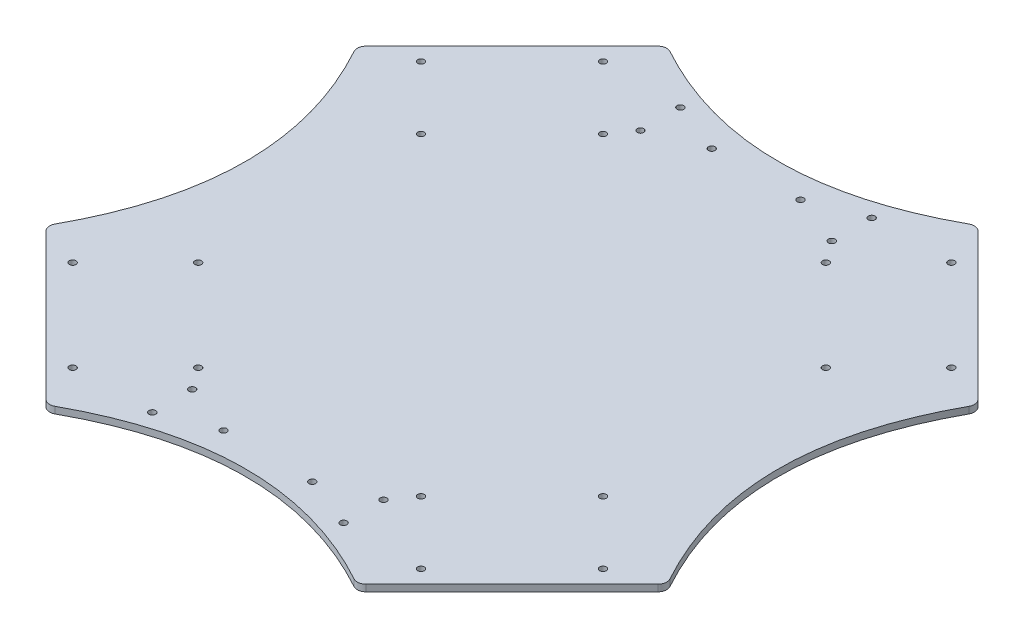
from build123d import *

# Parameters (mm, degrees)
DODANIE_WYCI_GNI_CIE1_DEPTH = 3
ZAOKR_GLENIE1_R             = 4
SZKIC2_R                    = 1.5
WYTNIJ_WYCI_GNI_CIE1_DEPTH  = 197.640104054
SZYK_KO_OWY1_COUNT          = 4
SZKIC3_R                    = 1.5
WYTNIJ_WYCI_GNI_CIE2_DEPTH  = 197.640104054
SZYK_KO_OWY2_OUTLINE_R      = 1.5
SZYK_KO_OWY2_DEPTH          = 3


# Read off the part's stored shape, not the designer's step: Szyk kołowy2
with BuildPart() as part:
    # Szkic1 → Dodanie-wyciągnięcie1 (new body)
    with BuildSketch(Plane(origin=(0, 0, 0), x_dir=(1, 0, 0), z_dir=(0, 1, 0))):
        with BuildLine():
            Line((-70, -140), (-140, -70))
            add(Edge.make_bspline(
                [(-140, 70), (-100, 0), (-140, -70)],
                knots=[0, 0, 0, 1, 1, 1], degree=2))
            Line((-140, 70), (-70, 140))
            add(Edge.make_bspline(
                [(70, 140), (0, 100), (-70, 140)],
                knots=[0, 0, 0, 1, 1, 1], degree=2))
            Line((70, 140), (140, 70))
            add(Edge.make_bspline(
                [(140, -70), (100, 0), (140, 70)],
                knots=[0, 0, 0, 1, 1, 1], degree=2))
            Line((140, -70), (70, -140))
            add(Edge.make_bspline(
                [(-70, -140), (0, -100), (70, -140)],
                knots=[0, 0, 0, 1, 1, 1], degree=2))
        make_face()
    extrude(amount=DODANIE_WYCI_GNI_CIE1_DEPTH)

    # Zaokrąglenie1
    zaokr_glenie1_edges = [part.edges().sort_by_distance(p)[0] for p in [
        (-140, 1.5, -70),
        (-70, 1.5, -140),
        (70, 1.5, -140),
        (140, 1.5, -70),
        (140, 1.5, 70),
        (70, 1.5, 140),
        (-140, 1.5, 70),
        (-70, 1.5, 140),
    ]]
    fillet(zaokr_glenie1_edges, radius=ZAOKR_GLENIE1_R)

    # Szkic2 → Wytnij-wyciągnięcie1 (cut, through all)
    with BuildSketch(Plane(origin=(0, 3, 0), x_dir=(1, 0, 0), z_dir=(0, 1, 0))):
        with Locations(Location((-78.488852712, -119.501046021, 0), (0, 0, 270))):
            Circle(SZKIC2_R)
        with Locations(Location((-119.501046021, -78.488852712, 0), (0, 0, 90))):
            Circle(SZKIC2_R)
        with Locations(Location((-50.204581464, -91.216774773, 0), (0, 0, 90))):
            Circle(SZKIC2_R)
        with Locations(Location((-91.216774773, -50.204581464, 0), (0, 0, 270))):
            Circle(SZKIC2_R)
    wytnij_wyci_gni_cie1 = extrude(amount=-WYTNIJ_WYCI_GNI_CIE1_DEPTH, mode=Mode.SUBTRACT)

    # Szyk kołowy1: Wytnij-wyciągnięcie1 ×4 about axis
    szyk_ko_owy1_axis = Axis((0, 0, 0), (0, 1, 0))
    for i in range(1, SZYK_KO_OWY1_COUNT):
        add(wytnij_wyci_gni_cie1.rotate(szyk_ko_owy1_axis, i * 360 / SZYK_KO_OWY1_COUNT), mode=Mode.SUBTRACT)

    # Szkic3 → Wytnij-wyciągnięcie2 (cut, through all)
    with BuildSketch(Plane(origin=(0, 3, 0), x_dir=(1, 0, 0), z_dir=(0, 1, 0))):
        with Locations(Location((-43.1, -119, 0), (0, 0, 270))):
            Circle(SZKIC3_R)
        with Locations(Location((-20, -110, 0), (0, 0, 270))):
            Circle(SZKIC3_R)
        with Locations(Location((-43.1, -101, 0), (0, 0, 90))):
            Circle(SZKIC3_R)
    wytnij_wyci_gni_cie2 = extrude(amount=-WYTNIJ_WYCI_GNI_CIE2_DEPTH, mode=Mode.SUBTRACT)

    # Lustro1: Wytnij-wyciągnięcie2 across plane
    add(wytnij_wyci_gni_cie2.mirror(Plane(origin=(0, 0, 0), x_dir=(0, 0, 1), z_dir=(1, 0, 0))), mode=Mode.SUBTRACT)

    # Szyk kołowy2 outline → Szyk kołowy2 (cut)
    with BuildSketch(Plane(origin=(0, 0, 0), x_dir=(1, 0, 0), z_dir=(0, 1, 0))):
        with Locations((-43.1, 101)):
            Circle(SZYK_KO_OWY2_OUTLINE_R)
        with Locations((-20, 110)):
            Circle(SZYK_KO_OWY2_OUTLINE_R)
        with Locations((-43.1, 119)):
            Circle(SZYK_KO_OWY2_OUTLINE_R)
        with Locations((43.1, 119)):
            Circle(SZYK_KO_OWY2_OUTLINE_R)
        with Locations((43.1, 101)):
            Circle(SZYK_KO_OWY2_OUTLINE_R)
        with Locations((20, 110)):
            Circle(SZYK_KO_OWY2_OUTLINE_R)
    extrude(amount=SZYK_KO_OWY2_DEPTH, mode=Mode.SUBTRACT)


solid = part.part
